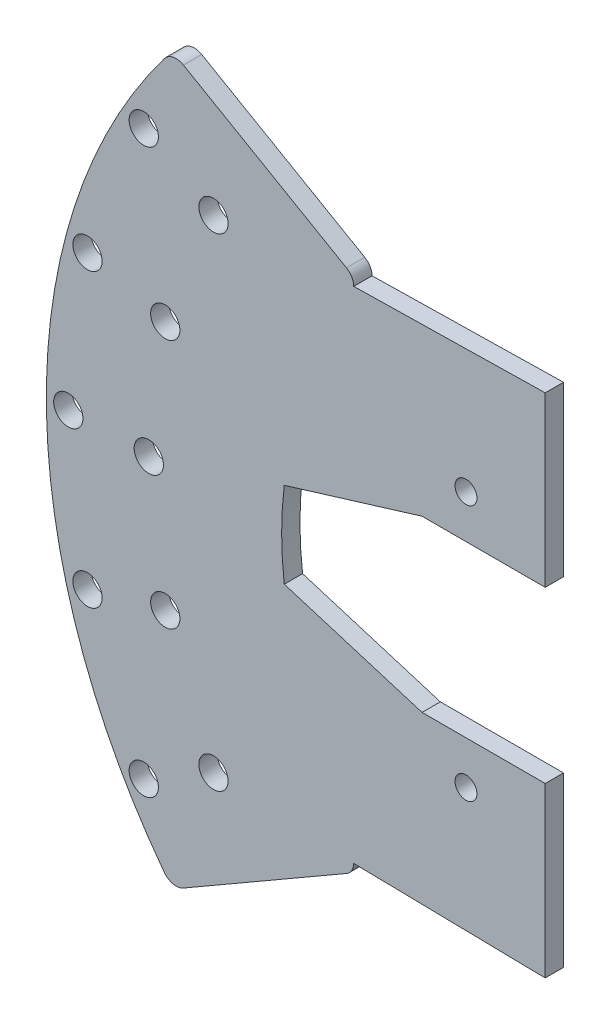
from build123d import *

# Parameters (mm, degrees)
CROQUIS1_R              = 2
SALIENTE_EXTRUIR1_DEPTH = 2.5
SALIENTE_EXTRUIR2_START = -2.5
SALIENTE_EXTRUIR2_DEPTH = 2.5
SALIENTE_EXTRUIR3_START = -2.5
SALIENTE_EXTRUIR3_DEPTH = 2.5
CROQUIS3_R              = 1.5
CORTAR_EXTRUIR1_DEPTH   = 10


# Read off the part's stored shape, not the designer's step: Saliente-Extruir2
with BuildPart() as part:
    # Croquis1 → Saliente-Extruir1 (new body)
    # profile 1 of 5: a face of its own
    with BuildSketch(Plane.XY):
        with BuildLine():
            Line((-21.120737491, -7.779592428), (-4.410977671, -7.779592428))
            ThreePointArc((-4.410977671, -7.779592428), (-3.91525524, -8.214329332), (-4.281568148, -8.762555341))
            Line((-4.281568148, -8.762555341), (-20.42195671, -13.087359421))
            ThreePointArc((-20.42195671, -13.087359421), (-18.774789479, -20.700029026), (-16.394943343, -28.116377909))
            Line((-16.394943343, -28.116377909), (-0.254554781, -23.791573829))
            ThreePointArc((-0.254554781, -23.791573829), (0.336794507, -24.083195026), (0.124854741, -24.707549444))
            Line((0.124854741, -24.707549444), (-14.346221754, -33.062429354))
            ThreePointArc((-14.346221754, -33.062429354), (-10.27145788, -40.865753752), (-5.363777272, -48.173984957))
            ThreePointArc((-5.363777272, -48.173984957), (-4.165388027, -48.929294708), (-2.76728992, -48.70136646))
            Line((-2.76728992, -48.70136646), (19.509218146, -35.840018532))
            ThreePointArc((19.509218146, -35.840018532), (20.480258523, -34.447083978), (20.030579853, -32.809715608))
            ThreePointArc((20.030579853, -32.809715608), (7.934326683, 0), (20.030579853, 32.809715608))
            ThreePointArc((20.030579853, 32.809715608), (20.480258523, 34.447083978), (19.509218146, 35.840018532))
            Line((19.509218146, 35.840018532), (-2.76728992, 48.70136646))
            ThreePointArc((-2.76728992, 48.70136646), (-4.165388027, 48.929294708), (-5.363777272, 48.173984957))
            ThreePointArc((-5.363777272, 48.173984957), (-10.27145788, 40.865753752), (-14.346221754, 33.062429354))
            Line((-14.346221754, 33.062429354), (0.124854741, 24.707549444))
            ThreePointArc((0.124854741, 24.707549444), (0.336794507, 24.083195026), (-0.254554781, 23.791573829))
            Line((-0.254554781, 23.791573829), (-16.394943343, 28.116377909))
            ThreePointArc((-16.394943343, 28.116377909), (-18.774789479, 20.700029026), (-20.42195671, 13.087359421))
            Line((-20.42195671, 13.087359421), (-4.281568148, 8.762555341))
            ThreePointArc((-4.281568148, 8.762555341), (-3.91525524, 8.214329332), (-4.410977671, 7.779592428))
            Line((-4.410977671, 7.779592428), (-21.120737491, 7.779592428))
            ThreePointArc((-21.120737491, 7.779592428), (-21.5, 0), (-21.120737491, -7.779592428))
        make_face()
        with Locations((-8.186800297, -38.489385282)):
            Circle(CROQUIS1_R, mode=Mode.SUBTRACT)
        with Locations((-15.877012, -19.92357189)):
            Circle(CROQUIS1_R, mode=Mode.SUBTRACT)
        with Locations((-5.251827911, -17.076562394)):
            Circle(CROQUIS1_R, mode=Mode.SUBTRACT)
        with Locations((1.339479145, -32.989385282)):
            Circle(CROQUIS1_R, mode=Mode.SUBTRACT)
        with Locations((-18.5, 0)):
            Circle(CROQUIS1_R, mode=Mode.SUBTRACT)
        with Locations((-15.877012, 19.92357189)):
            Circle(CROQUIS1_R, mode=Mode.SUBTRACT)
        with Locations((-7.5, 0)):
            Circle(CROQUIS1_R, mode=Mode.SUBTRACT)
        with Locations((-5.251827911, 17.076562394)):
            Circle(CROQUIS1_R, mode=Mode.SUBTRACT)
        with Locations((-8.186800297, 38.489385282)):
            Circle(CROQUIS1_R, mode=Mode.SUBTRACT)
        with Locations((1.339479145, 32.989385282)):
            Circle(CROQUIS1_R, mode=Mode.SUBTRACT)
    # profile 2 of 5: a face of its own
    with BuildSketch(Plane.XY):
        with BuildLine():
            ThreePointArc((-14.346221754, 33.062429354), (-15.411978596, 30.606550436), (-16.394943343, 28.116377909))
            Line((-16.394943343, 28.116377909), (-0.254554781, 23.791573829))
            ThreePointArc((-0.254554781, 23.791573829), (0.336794507, 24.083195026), (0.124854741, 24.707549444))
            Line((0.124854741, 24.707549444), (-14.346221754, 33.062429354))
        make_face()
    # profile 3 of 5: a face of its own
    with BuildSketch(Plane.XY):
        with BuildLine():
            ThreePointArc((-20.42195671, 13.087359421), (-20.815770531, 10.43932438), (-21.120737491, 7.779592428))
            Line((-21.120737491, 7.779592428), (-4.410977671, 7.779592428))
            ThreePointArc((-4.410977671, 7.779592428), (-3.91525524, 8.214329332), (-4.281568148, 8.762555341))
            Line((-4.281568148, 8.762555341), (-20.42195671, 13.087359421))
        make_face()
    # profile 4 of 5: a face of its own
    with BuildSketch(Plane.XY):
        with BuildLine():
            ThreePointArc((-4.281568148, -8.762555341), (-3.91525524, -8.214329332), (-4.410977671, -7.779592428))
            Line((-4.410977671, -7.779592428), (-21.120737491, -7.779592428))
            ThreePointArc((-21.120737491, -7.779592428), (-20.815770531, -10.43932438), (-20.42195671, -13.087359421))
            Line((-20.42195671, -13.087359421), (-4.281568148, -8.762555341))
        make_face()
    # profile 5 of 5: a face of its own
    with BuildSketch(Plane.XY):
        with BuildLine():
            Line((-0.254554781, -23.791573829), (-16.394943343, -28.116377909))
            ThreePointArc((-16.394943343, -28.116377909), (-15.411978596, -30.606550436), (-14.346221754, -33.062429354))
            Line((-14.346221754, -33.062429354), (0.124854741, -24.707549444))
            ThreePointArc((0.124854741, -24.707549444), (0.336794507, -24.083195026), (-0.254554781, -23.791573829))
        make_face()
    extrude(amount=SALIENTE_EXTRUIR1_DEPTH)

    # Saliente-Extruir2 outline → Saliente-Extruir2 (add)
    with BuildSketch(Plane.XY.offset(SALIENTE_EXTRUIR2_START)):
        with BuildLine():
            Line((-0.254554781, -23.791573829), (-16.394943343, -28.116377909))
            ThreePointArc((-16.394943343, -28.116377909), (-15.411978595, -30.606550436), (-14.346221754, -33.062429354))
            Line((-14.346221754, -33.062429354), (0.124854741, -24.707549444))
            ThreePointArc((0.124854741, -24.707549444), (0.336794507, -24.083195026), (-0.254554781, -23.791573829))
        make_face()
        with BuildLine():
            Line((-4.410977671, -7.779592428), (-21.120737491, -7.779592428))
            ThreePointArc((-21.120737491, -7.779592428), (-20.815770531, -10.43932438), (-20.42195671, -13.087359421))
            Line((-20.42195671, -13.087359421), (-4.281568148, -8.762555341))
            ThreePointArc((-4.281568148, -8.762555341), (-3.91525524, -8.214329332), (-4.410977671, -7.779592428))
        make_face()
        with BuildLine():
            Line((-4.281568148, 8.762555341), (-20.42195671, 13.087359421))
            ThreePointArc((-20.42195671, 13.087359421), (-20.815770531, 10.43932438), (-21.120737491, 7.779592428))
            Line((-21.120737491, 7.779592428), (-4.410977671, 7.779592428))
            ThreePointArc((-4.410977671, 7.779592428), (-3.91525524, 8.214329332), (-4.281568148, 8.762555341))
        make_face()
        with BuildLine():
            Line((-16.394943343, 28.116377909), (-0.254554781, 23.791573829))
            ThreePointArc((-0.254554781, 23.791573829), (0.336794507, 24.083195026), (0.124854741, 24.707549444))
            Line((0.124854741, 24.707549444), (-14.346221754, 33.062429354))
            ThreePointArc((-14.346221754, 33.062429354), (-15.411978595, 30.606550436), (-16.394943343, 28.116377909))
        make_face()
    extrude(amount=SALIENTE_EXTRUIR2_DEPTH)

    # Croquis2 → Saliente-Extruir3 (add)
    with BuildSketch(Plane.XY.offset(2.5).offset(SALIENTE_EXTRUIR3_START)):
        with BuildLine():
            ThreePointArc((20.030579853, 32.809715608), (11.054709029, 17.484255625), (7.934326683, 0))
            Line((7.934326683, 0), (10.654225828, 0))
            ThreePointArc((10.654225828, 0), (10.744136996, 2.931183608), (11.013532431, 5.85134584))
            Line((11.013532431, 5.85134584), (29.845645811, 11.606363843))
            Line((29.845645811, 11.606363843), (46.670524679, 11.606363843))
            Line((46.670524679, 11.606363843), (46.670524679, 34.626841689))
            Line((46.670524679, 34.626841689), (20.50887875, 34.144811605))
            ThreePointArc((20.50887875, 34.144811605), (20.392040458, 33.433445566), (20.030579853, 32.809715608))
        make_face()
        with BuildLine():
            Line((10.654225828, 0), (7.934326683, 0))
            ThreePointArc((7.934326683, 0), (11.054709029, -17.484255625), (20.030579853, -32.809715608))
            ThreePointArc((20.030579853, -32.809715608), (20.392040458, -33.433445566), (20.50887875, -34.144811605))
            Line((20.50887875, -34.144811605), (46.670524679, -34.626841689))
            Line((46.670524679, -34.626841689), (46.670524679, -11.606363843))
            Line((46.670524679, -11.606363843), (29.845645811, -11.606363843))
            Line((29.845645811, -11.606363843), (11.013532431, -5.85134584))
            ThreePointArc((11.013532431, -5.85134584), (10.744136996, -2.931183608), (10.654225828, 0))
        make_face()
    extrude(amount=SALIENTE_EXTRUIR3_DEPTH)

    # Croquis3 → Cortar-Extruir1 (cut)
    with BuildSketch(Plane.XY.offset(2.5)):
        with Locations((35.845645811, -17.5)):
            Circle(CROQUIS3_R)
        with Locations((35.845645811, 17.5)):
            Circle(CROQUIS3_R)
    extrude(amount=-CORTAR_EXTRUIR1_DEPTH, mode=Mode.SUBTRACT)


solid = part.part
